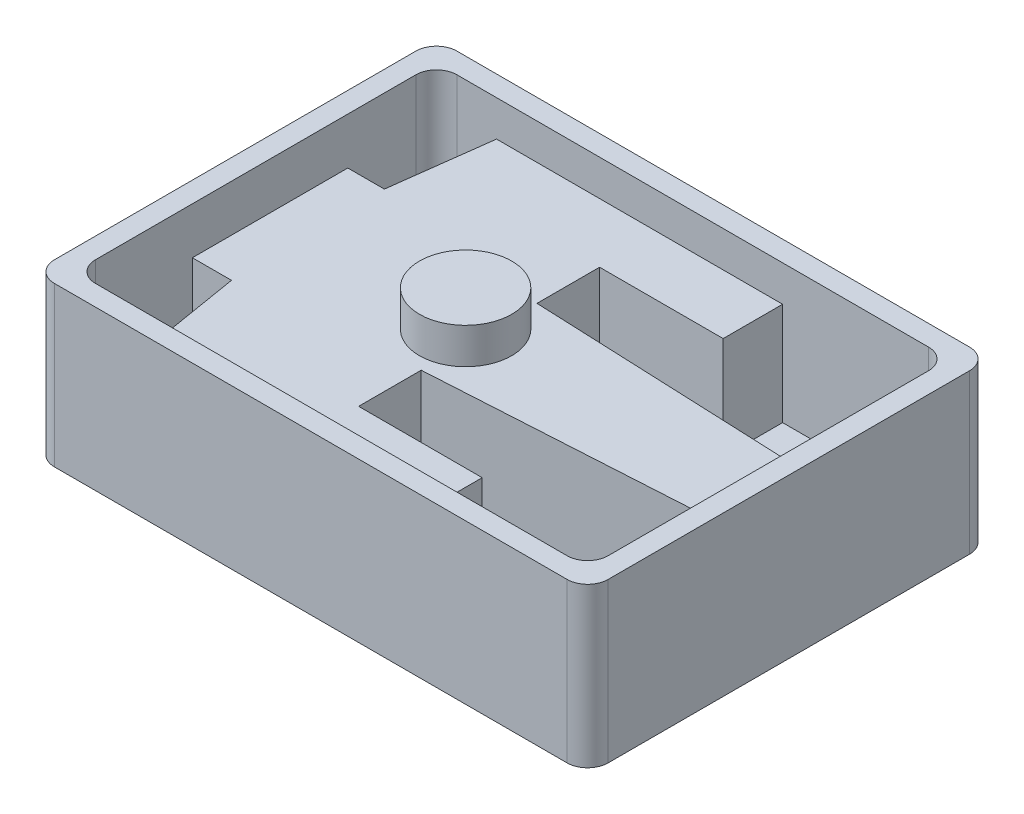
from build123d import *

# Parameters (mm, degrees)
SKETCH1_W              = 54
SKETCH1_H              = 39.25
BOSS_EXTRUDE1_DEPTH    = 46.5
FILLET1_R              = 2
FILLET2_R              = 2
Z_95_START             = -0.023652431
Z_95_BLANK_DEPTH       = 10
Z_95_START_2           = -5.023652431
Z_95_BLANK_2_OUTLINE_R = 2.5
Z_95_BLANK_2_DEPTH     = 5
BODY_MOVE_COPY3_ANGLE  = 180
BODY_MOVE_COPY4_ANGLE  = 89.5
SKETCH4_W              = 54
SKETCH4_H              = 39.25
CUT_EXTRUDE1_DEPTH     = 31
CUT_EXTRUDE2_DEPTH     = 31
BOSS_EXTRUDE2_DEPTH    = 2
FILLET3_R              = 2
FILLET4_R              = 2
FILLET5_R              = 2
FILLET6_R              = 2
SKETCH7_R              = 4.5
CUT_EXTRUDE3_DEPTH     = 3.5


with BuildPart() as part:
    # Sketch1 → Boss-Extrude1 (new body)
    with BuildSketch(Plane(origin=(0, 0, 0), x_dir=(1, 0, 0), z_dir=(0, 1, 0))):
        with Locations((27, 19.625)):
            Rectangle(SKETCH1_W, SKETCH1_H)
    extrude(amount=BOSS_EXTRUDE1_DEPTH)

    # Fillet1
    fillet1_edges = [part.edges().sort_by_distance(p)[0] for p in [
        (0, 23.25, 0),
    ]]
    fillet(fillet1_edges, radius=FILLET1_R)

    # Fillet2
    fillet2_edges = [part.edges().sort_by_distance(p)[0] for p in [
        (0, 23.25, -39.25),
        (54, 23.25, -39.25),
        (54, 23.25, 0),
    ]]
    fillet(fillet2_edges, radius=FILLET2_R)


with BuildPart() as body_2:
    # Z-95 Blank: read off the stored shape, not the designer's step
    # Z-95 Blank outline → Z-95 Blank (new body)
    with BuildSketch(Plane(origin=(0, 0, 0), x_dir=(1, 0, 0), z_dir=(0, 1, 0)).offset(Z_95_START)):
        Polygon((-39.475833264, 51.689675598), (-39.475833264, 48.062948495), (-51.475833264, 46.678320586), (-51.475833264, 23.139646129), (-47.225833264, 23.139646129), (-47.225833264, 35.139646129), (-37.225833264, 35.139646129), (-35.725833264, 5.689675598), (-31.225833264, 5.689675598), (-29.725833264, 35.139646129), (-19.725833264, 35.139646129), (-19.725833264, 23.139646129), (-15.475833264, 23.139646129), (-15.475833264, 46.678320586), (-27.475833264, 48.062948495), (-27.475833264, 51.689675598), align=None)
    extrude(amount=Z_95_BLANK_DEPTH)

    # Z-95 Blank 2 outline → Z-95 Blank 2 (add)
    with BuildSketch(Plane(origin=(0, 0, 0), x_dir=(1, 0, 0), z_dir=(0, 1, 0)).offset(Z_95_START_2)):
        with Locations((-33.475833264, 34.343753809)):
            Circle(Z_95_BLANK_2_OUTLINE_R)
    extrude(amount=Z_95_BLANK_2_DEPTH)


with BuildPart() as body_2_1:
    # Body-Move/Copy3: moved
    add(body_2.part.rotate(Axis((0, 2.476347569, -28.689675598), (1, 0, 0)), BODY_MOVE_COPY3_ANGLE))


with BuildPart() as body_2_2:
    # Body-Move/Copy4: moved
    add(body_2_1.part.rotate(Axis((-33.475833264, 0, -28.689675598), (0, -1, 0)), BODY_MOVE_COPY4_ANGLE))


with BuildPart() as body_2_3:
    # Body-Move/Copy5: moved
    add(body_2_2.part.moved(Location((61.536777905, 5.06338101, 8.948981511))))


with BuildPart() as body_2_4:
    # Body-Move/Copy6: moved
    add(body_2_3.part.moved(Location((0, -0.229742035, 0))))


with BuildPart() as part_1:
    add(part.part)

    # Intersect1: read off the stored shape, not the designer's step
    # Intersect1: cut body 2
    add(body_2_4.part, mode=Mode.SUBTRACT)

    # Sketch4 → Cut-Extrude1 (cut)
    with BuildSketch(Plane(origin=(0, 46.5, 0), x_dir=(1, 0, 0), z_dir=(0, 1, 0))):
        with Locations((27, 19.625)):
            Rectangle(SKETCH4_W, SKETCH4_H)
    extrude(amount=-CUT_EXTRUDE1_DEPTH, mode=Mode.SUBTRACT)

    # Sketch5 → Cut-Extrude2 (cut)
    with BuildSketch(Plane(origin=(0, 0, 0), x_dir=(-1, 0, 0), z_dir=(0, -1, 0))):
        Polygon((-23.713680343, 7.952308665), (-23.713680343, 14.054528407), (-52, 15.742860627), (-52, 2), (-35.766082295, 2), (-35.766082295, 7.952308665), align=None)
        Polygon((-23.713680343, 25.345964802), (-23.713680343, 31.453203507), (-35.766082295, 31.453203507), (-35.766082295, 37.25), (-52, 37.25), (-52, 24.152615413), align=None)
        Polygon((-6.871546498, 12.395456139), (-8.594812047, 2), (-2, 2), (-2, 37.25), (-7.869100925, 37.25), (-6.622123507, 27.553904956), (-3.057950712, 27.553904956), (-3.057950712, 12.395456139), align=None)
    extrude(amount=-CUT_EXTRUDE2_DEPTH, mode=Mode.SUBTRACT)

    # Sketch6 → Boss-Extrude2 (add)
    with BuildSketch(Plane.XZ):
        Polygon((52, -24.152615413), (23.713680343, -25.345964802), (23.713680343, -31.453203507), (35.766082295, -31.453203507), (35.766082295, -37.25), (52, -37.25), align=None)
        Polygon((52, -15.742860627), (23.713680343, -14.054528407), (23.713680343, -7.952308665), (35.766082295, -7.952308665), (35.766082295, -2), (52, -2), align=None)
        Polygon((8.594812047, -2), (6.871546498, -12.395456139), (3.057950712, -12.395456139), (3.057950712, -27.553904956), (6.622123507, -27.553904956), (7.869100925, -37.25), (2, -37.25), (2, -2), align=None)
    extrude(amount=-BOSS_EXTRUDE2_DEPTH)

    # Fillet3
    fillet3_edges = [part_1.edges().sort_by_distance(p)[0] for p in [
        (52, 8.75, -2),
    ]]
    fillet(fillet3_edges, radius=FILLET3_R)

    # Fillet4
    fillet4_edges = [part_1.edges().sort_by_distance(p)[0] for p in [
        (2, 8.75, -2),
    ]]
    fillet(fillet4_edges, radius=FILLET4_R)

    # Fillet5
    fillet5_edges = [part_1.edges().sort_by_distance(p)[0] for p in [
        (52, 8.75, -37.25),
    ]]
    fillet(fillet5_edges, radius=FILLET5_R)

    # Fillet6
    fillet6_edges = [part_1.edges().sort_by_distance(p)[0] for p in [
        (2, 8.75, -37.25),
    ]]
    fillet(fillet6_edges, radius=FILLET6_R)

    # Sketch7 → Cut-Extrude3 (cut)
    with BuildSketch(Plane(origin=(0, 15.5, 0), x_dir=(1, 0, 0), z_dir=(0, 1, 0))):
        Polygon((7.869100925, 37.25), (35.766082295, 37.25), (35.766082295, 31.453203507), (23.713680343, 31.453203507), (23.713680343, 25.345964802), (52, 24.152615413), (52, 15.742860627), (23.713680343, 14.054528407), (23.713680343, 7.952308665), (35.766082295, 7.952308665), (35.766082295, 2), (8.594812047, 2), (6.871546498, 12.395456139), (3.057950712, 12.395456139), (3.057950712, 27.553904956), (6.622123507, 27.553904956), align=None)
        with Locations(Location((22.40708172, 19.691353573, 0), (0, 0, 270))):
            Circle(SKETCH7_R, mode=Mode.SUBTRACT)
    extrude(amount=-CUT_EXTRUDE3_DEPTH, mode=Mode.SUBTRACT)


solid = part_1.part
